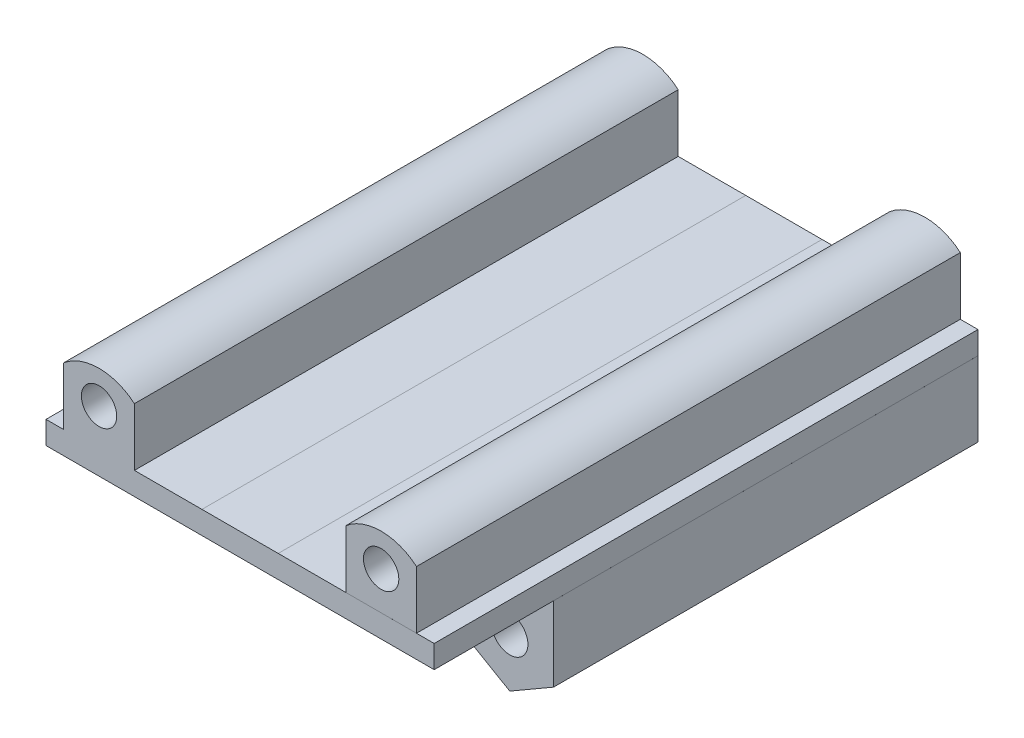
from build123d import *

# Parameters (mm, degrees)
BOSS_EXTRUDE2_DEPTH     = 24
BOSS_EXTRUDE2_2_DEPTH   = 24
SKETCH6_R               = 1.025
CUT_EXTRUDE1_DEPTH      = 5
CUT_EXTRUDE2_START      = -5
SKETCH7_R               = 1.025
CUT_EXTRUDE2_DEPTH      = 5
SKETCH8_R               = 0.9
CUT_EXTRUDE3_DEPTH      = 14
CUT_EXTRUDE4_DEPTH      = 24
BOSS_EXTRUDE3_DEPTH     = 24
SKETCH13_R              = 1
CUT_EXTRUDE5_DEPTH      = 24
BOSS_EXTRUDE5_OUTLINE_R = 1
BOSS_EXTRUDE5_DEPTH     = 6.75


# Read off the part's stored shape, not the designer's step: Boss-Extrude5
with BuildPart() as part:
    # Sketch3 → Boss-Extrude2 (new body)
    with BuildSketch(Plane.XY):
        with BuildLine():
            Line((0, 1.284473501), (0, -4.23))
            Line((0, -4.23), (2.475, -5.663169564))
            Line((2.475, -5.663169564), (4.95, -4.23))
            Line((4.95, -4.23), (4.95, 0))
            Line((4.95, 0), (10.974918748, 0))
            Line((10.974918748, 0), (17, -0.000257875))
            Line((17, -0.000257875), (17, 0))
            Line((17, 0), (21.949837505, 0))
            Line((21.949837505, 0), (21.949892461, 1.28400377))
            Line((21.949892461, 1.28400377), (13.928131848, 1.284347104))
            Line((13.928131848, 1.284347104), (13.13155756, 1.284381197))
            Line((13.13155756, 1.284381197), (12.329651428, 1.886055123))
            ThreePointArc((12.329651428, 1.886055123), (12.474649771, 2.499007586), (12.355214929, 3.117449627))
            ThreePointArc((12.355214929, 3.117449627), (10.359172253, 3.897908673), (9.620266793, 1.886113105))
            Line((9.620266793, 1.886113105), (8.81833491, 1.284473501))
            Line((8.81833491, 1.284473501), (0, 1.284473501))
        make_face()
    extrude(amount=BOSS_EXTRUDE2_DEPTH)


with BuildPart() as body_2:
    # Sketch3 → Boss-Extrude2 2 (new body)
    with BuildSketch(Plane.XY):
        Polygon((21.949837485, -0.00046973), (17, -0.000257875), (17, -4.23), (19.475, -5.663169564), (21.95, -4.23), (21.95, 0), (21.949837505, 0), align=None)
    extrude(amount=BOSS_EXTRUDE2_2_DEPTH)


with BuildPart() as cut_extrude1_tool:
    # Sketch6 → Cut-Extrude1 (new body)
    with BuildSketch(Plane.XY.offset(24)):
        with Locations((2.475, -2.863169564)):
            Circle(SKETCH6_R)
        with Locations((19.475, -2.863169564)):
            Circle(SKETCH6_R)
    extrude(amount=-CUT_EXTRUDE1_DEPTH)


with BuildPart() as part_1:
    add(part.part)

    # Cut-Extrude1: cut by cut_extrude1_tool
    add(cut_extrude1_tool.part, mode=Mode.SUBTRACT)


with BuildPart() as body_2_1:
    add(body_2.part)

    # Cut-Extrude1: cut by cut_extrude1_tool
    add(cut_extrude1_tool.part, mode=Mode.SUBTRACT)


with BuildPart() as cut_extrude2_tool:
    # Sketch7 → Cut-Extrude2 (new body)
    with BuildSketch(Plane(origin=(0, 0, 0), x_dir=(-1, 0, 0), z_dir=(0, 0, -1)).offset(CUT_EXTRUDE2_START)):
        with Locations(Location((-19.475, -2.863169564, 0), (0, 0, 180))):
            Circle(SKETCH7_R)
        with Locations(Location((-2.475, -2.863169564, 0), (0, 0, 180))):
            Circle(SKETCH7_R)
    extrude(amount=CUT_EXTRUDE2_DEPTH)


with BuildPart() as part_2:
    add(part_1.part)

    # Cut-Extrude2: cut by cut_extrude2_tool
    add(cut_extrude2_tool.part, mode=Mode.SUBTRACT)


with BuildPart() as body_2_2:
    add(body_2_1.part)

    # Cut-Extrude2: cut by cut_extrude2_tool
    add(cut_extrude2_tool.part, mode=Mode.SUBTRACT)


with BuildPart() as cut_extrude3_tool:
    # Sketch8 → Cut-Extrude3 (new body)
    with BuildSketch(Plane(origin=(0, 0, 5), x_dir=(-1, 0, 0), z_dir=(0, 0, -1))):
        with Locations((-19.475, -2.863169564)):
            Circle(SKETCH8_R)
        with Locations((-2.475, -2.863169564)):
            Circle(SKETCH8_R)
    extrude(amount=-CUT_EXTRUDE3_DEPTH)


with BuildPart() as part_3:
    add(part_2.part)

    # Cut-Extrude3: cut by cut_extrude3_tool
    add(cut_extrude3_tool.part, mode=Mode.SUBTRACT)

    # Sketch9 → Cut-Extrude4 (cut)
    with BuildSketch(Plane.XY.offset(24)):
        Polygon((8.81833491, 1.284473501), (13.13155756, 1.284381197), (13.13155756, 4.431882999), (8.81833491, 4.431882999), align=None)
    extrude(amount=-CUT_EXTRUDE4_DEPTH, mode=Mode.SUBTRACT)

    # Sketch10 → Boss-Extrude3 (add)
    with BuildSketch(Plane.XY.offset(24)):
        with BuildLine():
            Line((0.99983047, 1.284473501), (4.99983047, 1.284473501))
            Line((4.99983047, 1.284473501), (4.99983047, 4.551800372))
            ThreePointArc((4.99983047, 4.551800372), (2.99983047, 5.284473501), (0.99983047, 4.551800372))
            Line((0.99983047, 4.551800372), (0.99983047, 1.284473501))
        make_face()
        with BuildLine():
            Line((20.950061999, 1.284473501), (16.950061999, 1.284473501))
            Line((16.950061999, 1.284473501), (16.950061999, 4.551800372))
            ThreePointArc((16.950061999, 4.551800372), (18.950061999, 5.284473501), (20.950061999, 4.551800372))
            Line((20.950061999, 4.551800372), (20.950061999, 1.284473501))
        make_face()
    extrude(amount=-BOSS_EXTRUDE3_DEPTH)


with BuildPart() as body_2_3:
    add(body_2_2.part)

    # Cut-Extrude3: cut by cut_extrude3_tool
    add(cut_extrude3_tool.part, mode=Mode.SUBTRACT)


with BuildPart() as boss_extrude3_piece_1:
    # of the separate pieces the step leaves, piece 1, a body of its own (boss_extrude3_pieces)
    add(part_3.part.solids().sort_by_distance((8.81833491, 1.284473501, 0))[0])


with BuildPart() as boss_extrude3_piece_2:
    # of the separate pieces the step leaves, piece 2, a body of its own (boss_extrude3_pieces)
    add(part_3.part.solids().sort_by_distance((20.950061999, 1.284473501, 24))[0])


with BuildPart() as cut_extrude5_tool:
    # Sketch13 → Cut-Extrude5 (new body)
    with BuildSketch(Plane.XY.offset(24)):
        with Locations((2.99983047, 3.434387417)):
            Circle(SKETCH13_R)
        with Locations((18.950061999, 3.434387417)):
            Circle(SKETCH13_R)
    extrude(amount=-CUT_EXTRUDE5_DEPTH)


with BuildPart() as boss_extrude3_piece_1_1:
    add(boss_extrude3_piece_1.part)

    # Cut-Extrude5: cut by cut_extrude5_tool
    add(cut_extrude5_tool.part, mode=Mode.SUBTRACT)


with BuildPart() as boss_extrude3_piece_2_1:
    add(boss_extrude3_piece_2.part)

    # Cut-Extrude5: cut by cut_extrude5_tool
    add(cut_extrude5_tool.part, mode=Mode.SUBTRACT)


    add(boss_extrude3_piece_1_1.part)  # Boss-Extrude5 merges Boss-Extrude3 piece 1
    # Boss-Extrude5 outline → Boss-Extrude5 (add)
    # profile 1 of 2: a face of its own
    with BuildSketch(Plane.XY.offset(24)):
        with BuildLine():
            Line((16.950061999, 1.284473501), (20.950061999, 1.284473501))
            Line((20.950061999, 1.284473501), (20.950061999, 4.551800372))
            ThreePointArc((20.950061999, 4.551800372), (18.950061999, 5.284473501), (16.950061999, 4.551800372))
            Line((16.950061999, 4.551800372), (16.950061999, 1.284473501))
        make_face()
        with Locations((18.950061999, 3.434387417)):
            Circle(BOSS_EXTRUDE5_OUTLINE_R, mode=Mode.SUBTRACT)
    # profile 2 of 2: a face of its own
    with BuildSketch(Plane.XY.offset(24)):
        with BuildLine():
            Line((13.13155756, 1.284381197), (8.81833491, 1.284473501))
            Line((8.81833491, 1.284473501), (4.99983047, 1.284473501))
            Line((4.99983047, 1.284473501), (4.99983047, 4.551800372))
            ThreePointArc((4.99983047, 4.551800372), (2.99983047, 5.284473501), (0.99983047, 4.551800372))
            Line((0.99983047, 4.551800372), (0.99983047, 1.284473501))
            Line((0.99983047, 1.284473501), (0, 1.284473501))
            Line((0, 1.284473501), (0, 0))
            Line((0, 0), (21.949837505, 0))
            Line((21.949837505, 0), (21.949892461, 1.28400377))
            Line((21.949892461, 1.28400377), (13.13155756, 1.284381197))
        make_face()
        with Locations((2.99983047, 3.434387417)):
            Circle(BOSS_EXTRUDE5_OUTLINE_R, mode=Mode.SUBTRACT)
    extrude(amount=BOSS_EXTRUDE5_DEPTH)


solid = Compound([body_2_3.part, boss_extrude3_piece_2_1.part])
